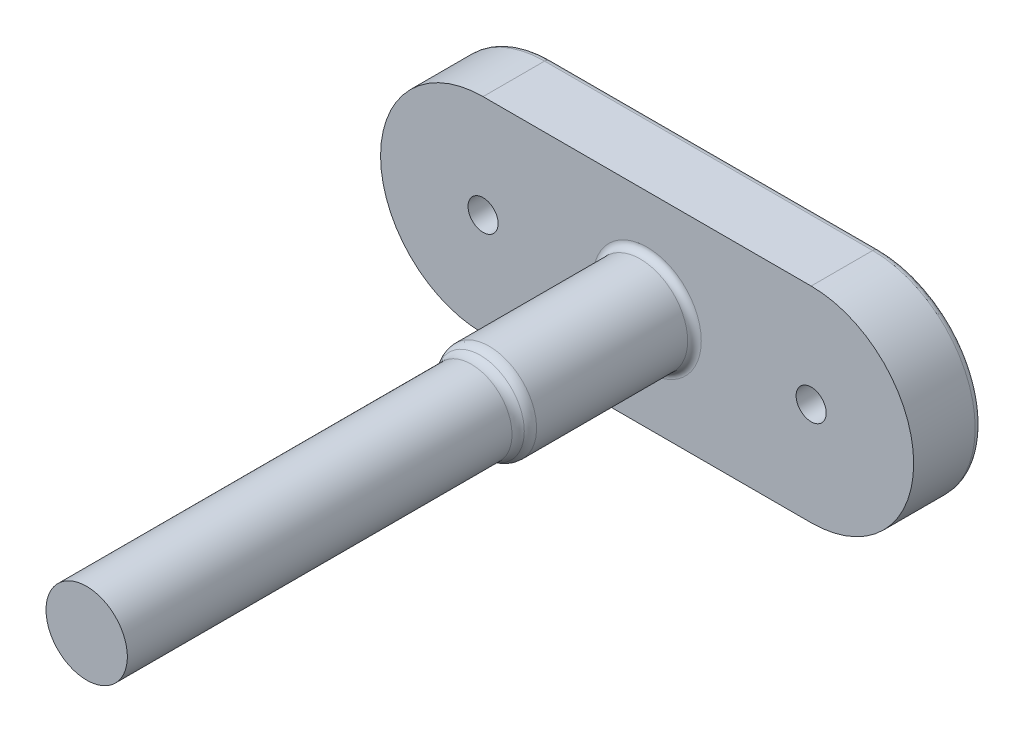
from build123d import *

# Parameters (mm, degrees)
SKETCH1_R           = 2.2
BOSS_EXTRUDE1_DEPTH = 10
SKETCH2_R           = 6.925
BOSS_EXTRUDE2_DEPTH = 24
SKETCH3_R           = 5.95
BOSS_EXTRUDE3_DEPTH = 58
FILLET1_R           = 2
FILLET2_R           = 2
FILLET3_R           = 1
FILLET4_R           = 1


with BuildPart() as part:
    # Sketch1 → Boss-Extrude1 (new body)
    with BuildSketch(Plane.XY):
        with BuildLine():
            Line((0, 15), (48, 15))
            ThreePointArc((48, 15), (63, 0), (48, -15))
            Line((48, -15), (0, -15))
            ThreePointArc((0, -15), (-15, 0), (0, 15))
        make_face()
        Circle(SKETCH1_R, mode=Mode.SUBTRACT)
        with Locations((48, 0)):
            Circle(SKETCH1_R, mode=Mode.SUBTRACT)
    extrude(amount=BOSS_EXTRUDE1_DEPTH)

    # Sketch2 → Boss-Extrude2 (add)
    with BuildSketch(Plane.XY.offset(10)):
        with Locations((24, 0)):
            Circle(SKETCH2_R)
    extrude(amount=BOSS_EXTRUDE2_DEPTH)

    # Sketch3 → Boss-Extrude3 (add)
    with BuildSketch(Plane.XY.offset(34)):
        with Locations(Location((24, 0, 0), (0, 0, 180))):
            Circle(SKETCH3_R)
    extrude(amount=BOSS_EXTRUDE3_DEPTH)

    # Fillet1
    # the kernel refuses this fillet: 2 mm, written as the material it adds along each edge
    with BuildSketch(Plane(origin=(24, 0, 34), x_dir=(-1, 0, 0), z_dir=(0, 1, 0))) as fillet1_piece_1:
        with BuildLine():
            CenterArc((7.95, 1.71737445), FILLET1_R, 180, 59.169502568)
            Line((5.95, 1.71737445), (5.91, 1.71737445))
            Line((5.91, 1.71737445), (5.91, 0))
            Line((5.91, 0), (5.95, -0.04))
            ThreePointArc((5.95, -0.04), (6.4375, -0.04), (6.9045, -0.034347489))
            Line((6.9045, -0.034347489), (6.925, 0))
        make_face()
    revolve(axis=Axis((24, 0, 34), (0, 0, 1)))

    # Fillet2
    fillet2_edges = [part.edges().sort_by_distance(p)[0] for p in [
        (24, -6.925, 34),
    ]]
    fillet(fillet2_edges, radius=FILLET2_R)

    # Fillet3
    fillet3_edges = [part.edges().sort_by_distance(p)[0] for p in [
        (17.075, 0, 10),
    ]]
    fillet(fillet3_edges, radius=FILLET3_R)

    # Fillet4
    fillet4_edges = [part.edges().sort_by_distance(p)[0] for p in [
        (24, 15, 0),
        (63, 0, 0),
        (24, -15, 0),
        (-15, 0, 0),
    ]]
    fillet(fillet4_edges, radius=FILLET4_R)


solid = part.part
